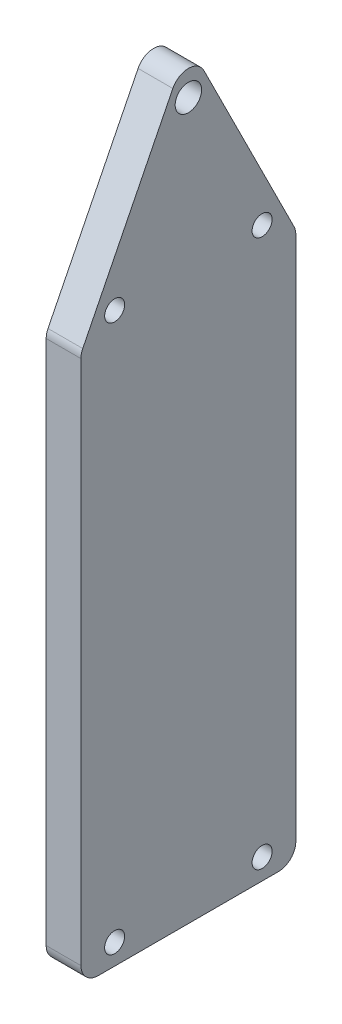
from build123d import *

# Parameters (mm, degrees)
SKETCH1_R           = 1.8288
SKETCH1_R_2         = 2.413
BOSS_EXTRUDE1_DEPTH = 6.35
FILLET1_R           = 3.175


with BuildPart() as part:
    # Sketch1 → Boss-Extrude1 (new body)
    with BuildSketch(Plane(origin=(0, 0, 0), x_dir=(0, 0, -1), z_dir=(1, 0, 0))):
        Polygon((19.639409497, -103.81), (19.639409497, -3.81), (0, 35.468818994), (-19.639409497, -3.81), (-19.639409497, -103.81), align=None)
        with Locations((-13.4747, -100)):
            Circle(SKETCH1_R, mode=Mode.SUBTRACT)
        with Locations((13.4747, -100)):
            Circle(SKETCH1_R, mode=Mode.SUBTRACT)
        with Locations((0, 26.9494)):
            Circle(SKETCH1_R_2, mode=Mode.SUBTRACT)
        with Locations((-13.4747, 0)):
            Circle(SKETCH1_R, mode=Mode.SUBTRACT)
        with Locations((13.4747, 0)):
            Circle(SKETCH1_R, mode=Mode.SUBTRACT)
    extrude(amount=BOSS_EXTRUDE1_DEPTH)

    # Fillet1
    fillet1_edges = [part.edges().sort_by_distance(p)[0] for p in [
        (3.175, 35.468818994, 0),
        (3.175, -103.81, 19.639409497),
        (3.175, -103.81, -19.639409497),
        (3.175, -3.81, 19.639409497),
        (3.175, -3.81, -19.639409497),
    ]]
    fillet(fillet1_edges, radius=FILLET1_R)


solid = part.part
